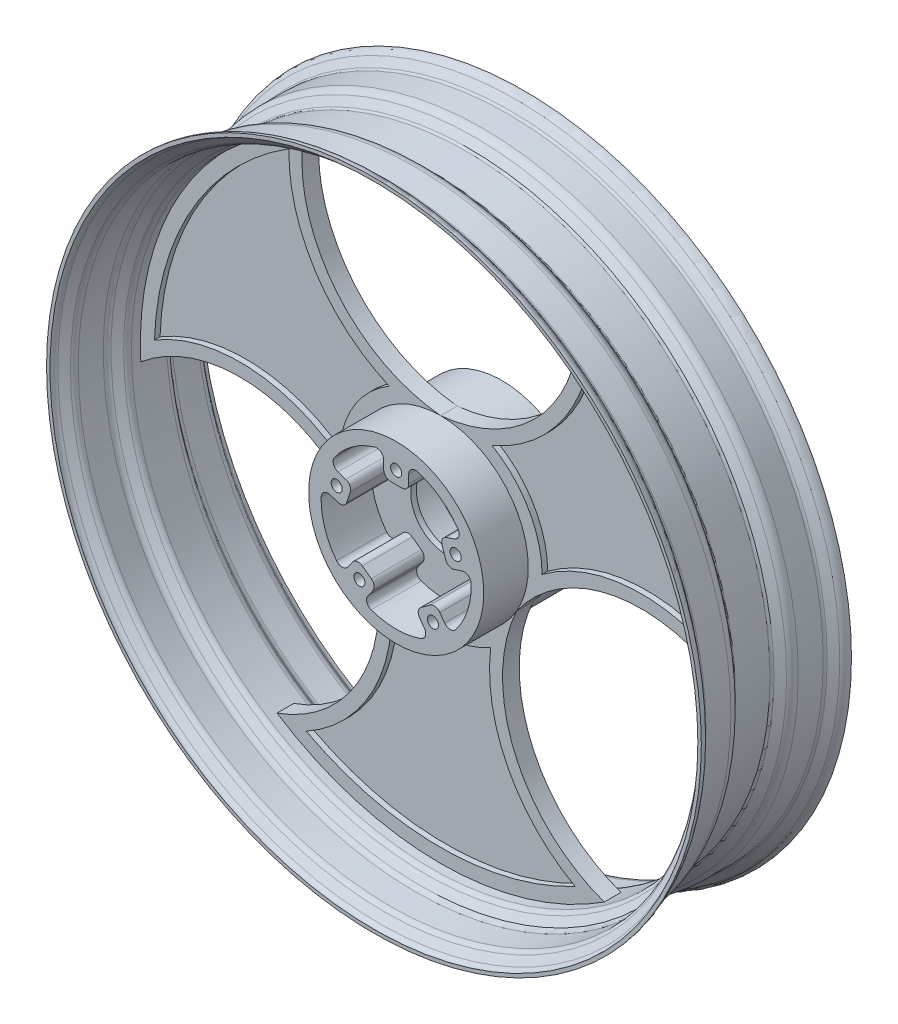
from build123d import *

# Parameters (mm, degrees)
CUT_EXTRUDE1_REACH   = 340.409
CIRPATTERN1_COUNT    = 3
CUT_EXTRUDE2_DEPTH   = 4
CIRPATTERN2_COUNT    = 3
MIRROR1_COPY_1_DEPTH = 4
MIRROR1_COPY_2_DEPTH = 4
CUT_EXTRUDE3_START   = -36
SKETCH4_R            = 54
CUT_EXTRUDE3_DEPTH   = 36
SKETCH5_R            = 25.5
CUT_EXTRUDE4_DEPTH   = 241
BOSS_EXTRUDE1_REACH  = 347.521
SKETCH7_R            = 4
CUT_EXTRUDE5_DEPTH   = 25
CIRPATTERN4_COUNT    = 5
FILLET1_START        = 2
FILLET1_DEPTH        = 37
FILLET1_START_2      = 1
FILLET1_2_DEPTH      = 37


with BuildPart() as part:
    # Sketch1 → Revolve1 (revolve)
    with BuildSketch(Plane(origin=(0, 0, 0), x_dir=(0, 0, -1), z_dir=(1, 0, 0)), mode=Mode.PRIVATE) as revolve1_sk:
        with BuildLine():
            Line((-38, 0), (38, 0))
            Line((38, 0), (38, 63))
            Line((38, 63), (6, 63))
            Line((6, 63), (6, 216))
            Line((6, 216), (12.409153107, 216))
            ThreePointArc((12.409153107, 216), (14.522244416, 216.468461065), (16.239375322, 217.786061952))
            Line((16.239375322, 217.786061952), (20.374354338, 222.713938048))
            ThreePointArc((20.374354338, 222.713938048), (22.091485245, 224.031538935), (24.204576553, 224.5))
            Line((24.204576553, 224.5), (42.204576553, 224.5))
            ThreePointArc((42.204576553, 224.5), (44.317667862, 224.968461065), (46.034798769, 226.286061952))
            Line((46.034798769, 226.286061952), (50.169777784, 231.213938048))
            ThreePointArc((50.169777784, 231.213938048), (51.886908691, 232.531538935), (54, 233))
            Line((54, 233), (54, 235.5))
            ThreePointArc((54, 235.5), (50.830363037, 234.797308403), (48.254666677, 232.820907073))
            Line((48.254666677, 232.820907073), (44.119687661, 227.893030976))
            ThreePointArc((44.119687661, 227.893030976), (43.261122208, 227.234230532), (42.204576553, 227))
            Line((42.204576553, 227), (24.204576553, 227))
            ThreePointArc((24.204576553, 227), (21.03493959, 226.297308403), (18.45924323, 224.320907073))
            Line((18.45924323, 224.320907073), (14.324264215, 219.393030976))
            ThreePointArc((14.324264215, 219.393030976), (13.465698761, 218.734230532), (12.409153107, 218.5))
            Line((12.409153107, 218.5), (0, 218.5))
            Line((0, 218.5), (-12.409153107, 218.5))
            ThreePointArc((-12.409153107, 218.5), (-13.465698761, 218.734230532), (-14.324264215, 219.393030976))
            Line((-14.324264215, 219.393030976), (-18.45924323, 224.320907073))
            ThreePointArc((-18.45924323, 224.320907073), (-21.03493959, 226.297308403), (-24.204576553, 227))
            Line((-24.204576553, 227), (-42.204576553, 227))
            ThreePointArc((-42.204576553, 227), (-43.261122208, 227.234230532), (-44.119687661, 227.893030976))
            Line((-44.119687661, 227.893030976), (-48.254666677, 232.820907073))
            ThreePointArc((-48.254666677, 232.820907073), (-50.830363037, 234.797308403), (-54, 235.5))
            Line((-54, 235.5), (-54, 233))
            ThreePointArc((-54, 233), (-51.886908691, 232.531538935), (-50.169777784, 231.213938048))
            Line((-50.169777784, 231.213938048), (-46.034798769, 226.286061952))
            ThreePointArc((-46.034798769, 226.286061952), (-44.317667862, 224.968461065), (-42.204576553, 224.5))
            Line((-42.204576553, 224.5), (-24.204576553, 224.5))
            ThreePointArc((-24.204576553, 224.5), (-22.091485245, 224.031538935), (-20.374354338, 222.713938048))
            Line((-20.374354338, 222.713938048), (-16.239375322, 217.786061952))
            ThreePointArc((-16.239375322, 217.786061952), (-14.522244416, 216.468461065), (-12.409153107, 216))
            Line((-12.409153107, 216), (-6, 216))
            Line((-6, 216), (-6, 63))
            Line((-6, 63), (-38, 63))
            Line((-38, 63), (-38, 0))
        make_face()
    revolve(revolve1_sk.sketch.rotate(Axis((0, 0, 108.105691878), (0, 0, -1)), 90), axis=Axis((0, 0, 108.105691878), (0, 0, -1)))

    # Sketch2 → Cut-Extrude1 (cut, up to next)
    with BuildSketch(Plane.XY.offset(6), mode=Mode.PRIVATE) as cut_extrude1_sk1:
        with BuildLine():
            ThreePointArc((0, 63), (77.538137266, 106.146211007), (98, 192.488960722))
            ThreePointArc((98, 192.488960722), (0, 216), (-98, 192.488960722))
            ThreePointArc((-98, 192.488960722), (-77.538137266, 106.146211007), (0, 63))
        make_face()
    cut_extrude1_tool1 = extrude(cut_extrude1_sk1.sketch, amount=-CUT_EXTRUDE1_REACH, mode=Mode.PRIVATE) & part.part
    cut_extrude1 = cut_extrude1_tool1.solids().sort_by_distance((0, 145.943107, 6))[0]
    add(cut_extrude1, mode=Mode.SUBTRACT)

    # CirPattern1: Cut-Extrude1 ×3 about axis
    cirpattern1_axis = Axis((0, 0, 0), (0, 0, 1))
    for i in range(1, CIRPATTERN1_COUNT):
        add(cut_extrude1.rotate(cirpattern1_axis, i * 360 / CIRPATTERN1_COUNT), mode=Mode.SUBTRACT)

    # Sketch3 → Cut-Extrude2 (cut)
    with BuildSketch(Plane.XY.offset(6)):
        with BuildLine():
            ThreePointArc((-205.874510366, 7.189296321), (-178.40123318, 103), (-109.163368432, 174.697907808))
            ThreePointArc((-109.163368432, 174.697907808), (-90.120860664, 107.821094199), (-37.03828108, 62.906007143))
            ThreePointArc((-37.03828108, 62.906007143), (-63.219854476, 36.5), (-72.997340776, 0.623088756))
            ThreePointArc((-72.997340776, 0.623088756), (-138.436236972, 24.136407646), (-205.874510366, 7.189296321))
        make_face()
    cut_extrude2 = extrude(amount=-CUT_EXTRUDE2_DEPTH, mode=Mode.SUBTRACT)

    # CirPattern2: Cut-Extrude2 ×3 about axis
    cirpattern2_axis = Axis((0, 0, 0), (0, 0, 1))
    for i in range(1, CIRPATTERN2_COUNT):
        add(cut_extrude2.rotate(cirpattern2_axis, i * 360 / CIRPATTERN2_COUNT), mode=Mode.SUBTRACT)

    # Mirror1: Cut-Extrude2 across plane
    add(cut_extrude2.mirror(Plane.XY), mode=Mode.SUBTRACT)

    # Mirror1 copy 1 sketch → Mirror1 copy 1 (cut)
    with BuildSketch(Plane(origin=(0, 0, -6), x_dir=(-0.4999999999999998, 0.8660254037844387, 0), z_dir=(0, 0, -1))):
        with BuildLine():
            ThreePointArc((-205.874510366, -7.189296321), (-178.40123318, -103), (-109.163368432, -174.697907808))
            ThreePointArc((-109.163368432, -174.697907808), (-90.120860664, -107.821094199), (-37.03828108, -62.906007143))
            ThreePointArc((-37.03828108, -62.906007143), (-63.219854476, -36.5), (-72.997340776, -0.623088756))
            ThreePointArc((-72.997340776, -0.623088756), (-138.436236972, -24.136407646), (-205.874510366, -7.189296321))
        make_face()
    extrude(amount=-MIRROR1_COPY_1_DEPTH, mode=Mode.SUBTRACT)

    # Mirror1 copy 2 sketch → Mirror1 copy 2 (cut)
    with BuildSketch(Plane(origin=(0, 0, -6), x_dir=(-0.5000000000000004, -0.8660254037844384, 0), z_dir=(0, 0, -1))):
        with BuildLine():
            ThreePointArc((-205.874510366, -7.189296321), (-178.40123318, -103), (-109.163368432, -174.697907808))
            ThreePointArc((-109.163368432, -174.697907808), (-90.120860664, -107.821094199), (-37.03828108, -62.906007143))
            ThreePointArc((-37.03828108, -62.906007143), (-63.219854476, -36.5), (-72.997340776, -0.623088756))
            ThreePointArc((-72.997340776, -0.623088756), (-138.436236972, -24.136407646), (-205.874510366, -7.189296321))
        make_face()
    extrude(amount=-MIRROR1_COPY_2_DEPTH, mode=Mode.SUBTRACT)

    # Sketch4 → Cut-Extrude3 (cut)
    with BuildSketch(Plane.XY.offset(38).offset(CUT_EXTRUDE3_START)):
        Circle(SKETCH4_R)
    cut_extrude3 = extrude(amount=CUT_EXTRUDE3_DEPTH, mode=Mode.SUBTRACT)

    # Mirror4: Cut-Extrude3 across plane
    add(cut_extrude3.mirror(Plane.XY), mode=Mode.SUBTRACT)

    # Sketch5 → Cut-Extrude4 (cut)
    with BuildSketch(Plane.XY.offset(2)):
        Circle(SKETCH5_R)
    extrude(amount=-CUT_EXTRUDE4_DEPTH, mode=Mode.SUBTRACT)

    # Sketch6 → Boss-Extrude1 (add, up to next)
    with BuildSketch(Plane.XY.offset(38), mode=Mode.PRIVATE) as boss_extrude1_sk1:
        with BuildLine():
            Line((-9, 36), (9, 36))
            Line((9, 36), (9, 53.244718048))
            ThreePointArc((9, 53.244718048), (0, 54), (-9, 53.244718048))
            Line((-9, 53.244718048), (-9, 36))
        make_face()
    boss_extrude1_tool1 = extrude(boss_extrude1_sk1.sketch, amount=-BOSS_EXTRUDE1_REACH, mode=Mode.PRIVATE) - part.part
    boss_extrude1 = boss_extrude1_tool1.solids().sort_by_distance((0, 44.875899, 38))[0]
    add(boss_extrude1)

    # Sketch7 → Cut-Extrude5 (cut)
    with BuildSketch(Plane.XY.offset(38)):
        with Locations((0, 45)):
            Circle(SKETCH7_R)
    cut_extrude5 = extrude(amount=-CUT_EXTRUDE5_DEPTH, mode=Mode.SUBTRACT)

    # CirPattern4: Boss-Extrude1, Cut-Extrude5 ×5 about axis
    cirpattern4_axis = Axis((0, 0, 0), (0, 0, 1))
    add([boss_extrude1.rotate(cirpattern4_axis, i * 360 / CIRPATTERN4_COUNT) for i in range(1, CIRPATTERN4_COUNT)])
    add([cut_extrude5.rotate(cirpattern4_axis, i * 360 / CIRPATTERN4_COUNT) for i in range(1, CIRPATTERN4_COUNT)], mode=Mode.SUBTRACT)

    # Fillet1: read off the stored shape, not the designer's step
    # Fillet1 outline → Fillet1 (cut)
    with BuildSketch(Plane.XY.offset(FILLET1_START)):
        with BuildLine():
            ThreePointArc((-35.474102564, 7.320385732), (-37.959432647, 4.410438083), (-41.774470117, 4.110188123))
            Line((-41.774470117, 4.110188123), (-37.019187536, 2.565103151))
            Line((-37.019187536, 2.565103151), (-35.474102564, 7.320385732))
        make_face()
        with BuildLine():
            ThreePointArc((-36.212164219, 21.229205416), (-33.30221657, 18.743875333), (-33.001966609, 14.928837863))
            Line((-33.001966609, 14.928837863), (-31.456881637, 19.684120444))
            Line((-31.456881637, 19.684120444), (-36.212164219, 21.229205416))
        make_face()
        with BuildLine():
            Line((-28.441422032, -23.834544527), (-31.380348293, -27.879629499))
            ThreePointArc((-31.380348293, -27.879629499), (-28.117435647, -25.880114057), (-24.39633706, -26.773470788))
            Line((-24.39633706, -26.773470788), (-28.441422032, -23.834544527))
        make_face()
        with BuildLine():
            Line((-13.879116133, -34.414679068), (-17.924201105, -31.475752807))
            ThreePointArc((-17.924201105, -31.475752807), (-15.924685664, -34.738665454), (-16.818042395, -38.45976404))
            Line((-16.818042395, -38.45976404), (-13.879116133, -34.414679068))
        make_face()
        with BuildLine():
            ThreePointArc((-4, 36), (-7.535533906, 37.464466094), (-9, 41))
            Line((-9, 41), (-9, 36))
            Line((-9, 36), (-4, 36))
        make_face()
        with BuildLine():
            ThreePointArc((9, 41), (7.535533906, 37.464466094), (4, 36))
            Line((4, 36), (9, 36))
            Line((9, 36), (9, 41))
        make_face()
        with BuildLine():
            Line((13.879116133, -34.414679068), (16.818042395, -38.45976404))
            ThreePointArc((16.818042395, -38.45976404), (15.924685664, -34.738665454), (17.924201105, -31.475752807))
            Line((17.924201105, -31.475752807), (13.879116133, -34.414679068))
        make_face()
        with BuildLine():
            Line((28.441422032, -23.834544527), (24.39633706, -26.773470788))
            ThreePointArc((24.39633706, -26.773470788), (28.117435647, -25.880114057), (31.380348293, -27.879629499))
            Line((31.380348293, -27.879629499), (28.441422032, -23.834544527))
        make_face()
        with BuildLine():
            ThreePointArc((33.001966609, 14.928837863), (33.30221657, 18.743875333), (36.212164219, 21.229205416))
            Line((36.212164219, 21.229205416), (31.456881637, 19.684120444))
            Line((31.456881637, 19.684120444), (33.001966609, 14.928837863))
        make_face()
        with BuildLine():
            ThreePointArc((41.774470117, 4.110188123), (37.959432647, 4.410438083), (35.474102564, 7.320385732))
            Line((35.474102564, 7.320385732), (37.019187536, 2.565103151))
            Line((37.019187536, 2.565103151), (41.774470117, 4.110188123))
        make_face()
    extrude(amount=FILLET1_DEPTH, mode=Mode.SUBTRACT)

    # Fillet1 2 outline → Fillet1 2 (add)
    with BuildSketch(Plane.XY.offset(FILLET1_START_2)):
        with BuildLine():
            ThreePointArc((-53.983916111, 1.317877593), (-51.874748664, 5.276500769), (-47.440320388, 5.951134471))
            Line((-47.440320388, 5.951134471), (-53.419889007, 7.894014091))
            ThreePointArc((-53.419889007, 7.894014091), (-53.802469565, 4.61457135), (-53.983916111, 1.317877593))
        make_face()
        with BuildLine():
            ThreePointArc((-34.882036336, -32.699289611), (-38.866103912, -34.759991024), (-42.899276543, -32.79713512))
            ThreePointArc((-42.899276543, -32.79713512), (-40.814735232, -35.357564791), (-38.57761298, -37.785814491))
            Line((-38.57761298, -37.785814491), (-34.882036336, -32.699289611))
        make_face()
        with BuildLine():
            Line((-47.857583108, 25.013031384), (-41.878014489, 23.070151765))
            ThreePointArc((-41.878014489, 23.070151765), (-45.069002583, 26.222433439), (-44.44853457, 30.664764382))
            ThreePointArc((-44.44853457, 30.664764382), (-46.239489202, 27.891031503), (-47.857583108, 25.013031384))
        make_face()
        with BuildLine():
            ThreePointArc((-9, 53.244718048), (-12.237159283, 52.595170241), (-15.428571429, 51.749001765))
            ThreePointArc((-15.428571429, 51.749001765), (-11.011928477, 50.966346156), (-9, 46.957427527))
            Line((-9, 46.957427527), (-9, 53.244718048))
        make_face()
        with BuildLine():
            ThreePointArc((-17.935323574, -50.934508619), (-21.048429355, -47.705289339), (-20.319730437, -43.279424153))
            Line((-20.319730437, -43.279424153), (-24.015307082, -48.365949032))
            ThreePointArc((-24.015307082, -48.365949032), (-21.014595587, -49.743208303), (-17.935323574, -50.934508619))
        make_face()
        with BuildLine():
            ThreePointArc((20.319730437, -43.279424153), (21.048429355, -47.705289339), (17.935323574, -50.934508619))
            ThreePointArc((17.935323574, -50.934508619), (21.014595587, -49.743208303), (24.015307082, -48.365949032))
            Line((24.015307082, -48.365949032), (20.319730437, -43.279424153))
        make_face()
        with BuildLine():
            Line((9, 53.244718048), (9, 46.957427527))
            ThreePointArc((9, 46.957427527), (11.011928477, 50.966346156), (15.428571429, 51.749001765))
            ThreePointArc((15.428571429, 51.749001765), (12.237159283, 52.595170241), (9, 53.244718048))
        make_face()
        with BuildLine():
            ThreePointArc((47.857583108, 25.013031384), (46.239489202, 27.891031503), (44.44853457, 30.664764382))
            ThreePointArc((44.44853457, 30.664764382), (45.069002583, 26.222433439), (41.878014489, 23.070151765))
            Line((41.878014489, 23.070151765), (47.857583108, 25.013031384))
        make_face()
        with BuildLine():
            ThreePointArc((42.899276543, -32.79713512), (38.866103912, -34.759991024), (34.882036336, -32.699289611))
            Line((34.882036336, -32.699289611), (38.57761298, -37.785814491))
            ThreePointArc((38.57761298, -37.785814491), (40.814735232, -35.357564791), (42.899276543, -32.79713512))
        make_face()
        with BuildLine():
            ThreePointArc((47.440320388, 5.951134471), (51.874748664, 5.276500769), (53.983916111, 1.317877593))
            ThreePointArc((53.983916111, 1.317877593), (53.802469565, 4.61457135), (53.419889007, 7.894014091))
            Line((53.419889007, 7.894014091), (47.440320388, 5.951134471))
        make_face()
    extrude(amount=FILLET1_2_DEPTH)


solid = part.part
